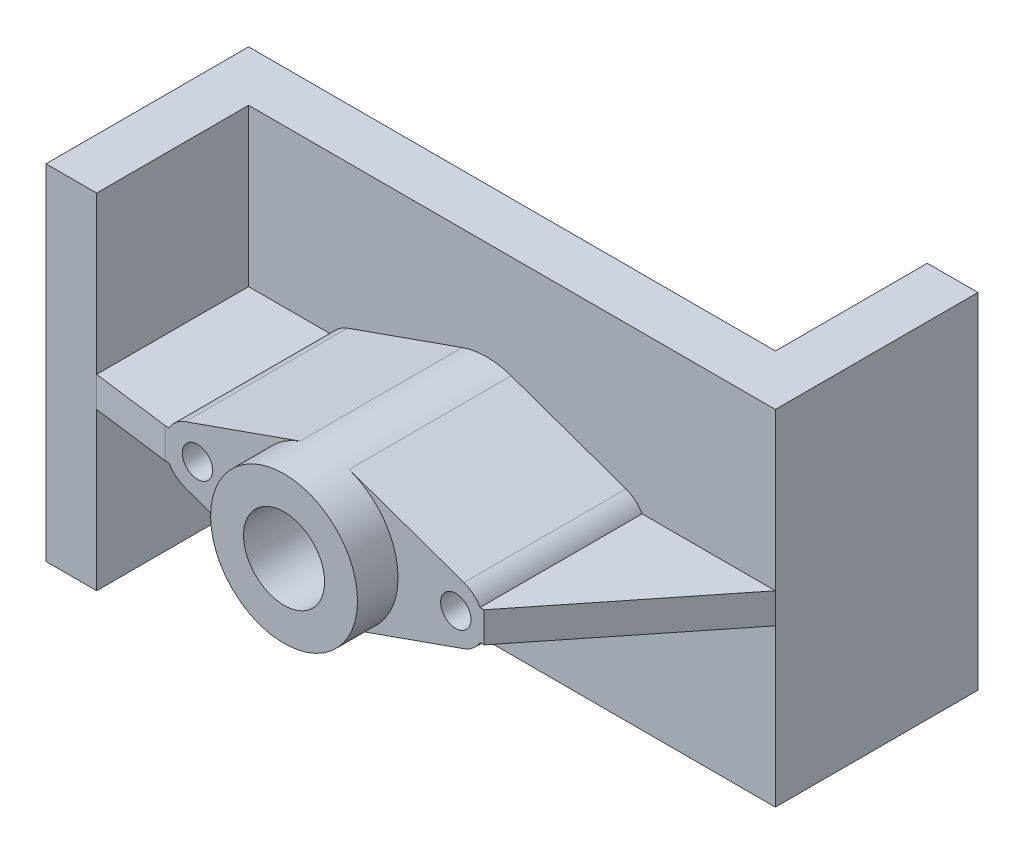
from build123d import *

# Parameters (mm, degrees)
ESTRUSIONE_ESTRUSIONE5_DEPTH = 34
ESTRUSIONE_ESTRUSIONE6_DEPTH = 32
SCHIZZO9_R                   = 14.5
ESTRUSIONE_ESTRUSIONE7_DEPTH = 8
SCHIZZO10_R                  = 8
TAGLIO_ESTRUSIONE1_DEPTH     = 104.947101932
SCHIZZO11_R                  = 3
TAGLIO_ESTRUSIONE2_DEPTH     = 98.923439482
NERVATURA1_START             = -3
NERVATURA1_DEPTH             = 6
NERVATURA11_START            = -3
NERVATURA11_DEPTH            = 6


with BuildPart() as part:
    # Schizzo7 → Estrusione-Estrusione5 (new, symmetric)
    with BuildSketch(Plane(origin=(0, 0, 0), x_dir=(1, 0, 0), z_dir=(0, 1, 0))):
        Polygon((-57, 20), (-57, -20), (-47, -20), (-47, 10), (57, 10), (57, 50), (47, 50), (47, 20), align=None)
    extrude(amount=ESTRUSIONE_ESTRUSIONE5_DEPTH, both=True)

    # Schizzo8 → Estrusione-Estrusione6 (add)
    with BuildSketch(Plane.XY.offset(-10)):
        with BuildLine():
            Line((-27.5, 5.656854249), (-4.833333333, 13.670731103))
            ThreePointArc((-4.833333333, 13.670731103), (0, 14.5), (4.833333333, 13.670731103))
            Line((4.833333333, 13.670731103), (27.5, 5.656854249))
            ThreePointArc((27.5, 5.656854249), (31.5, 0), (27.5, -5.656854249))
            Line((27.5, -5.656854249), (4.833333333, -13.670731103))
            ThreePointArc((4.833333333, -13.670731103), (0, -14.5), (-4.833333333, -13.670731103))
            Line((-4.833333333, -13.670731103), (-27.5, -5.656854249))
            ThreePointArc((-27.5, -5.656854249), (-31.5, 0), (-27.5, 5.656854249))
        make_face()
    extrude(amount=ESTRUSIONE_ESTRUSIONE6_DEPTH)

    # Schizzo9 → Estrusione-Estrusione7 (add)
    with BuildSketch(Plane.XY.offset(22)):
        with Locations(Location((0, 0, 0), (0, 0, 109.471220634))):
            Circle(SCHIZZO9_R)
    extrude(amount=ESTRUSIONE_ESTRUSIONE7_DEPTH)

    # Schizzo10 → Taglio-Estrusione1 (cut, through all)
    with BuildSketch(Plane.XY.offset(30)):
        Circle(SCHIZZO10_R)
    extrude(amount=-TAGLIO_ESTRUSIONE1_DEPTH, mode=Mode.SUBTRACT)

    # Schizzo11 → Taglio-Estrusione2 (cut, through all)
    with BuildSketch(Plane.XY.offset(22)):
        with Locations((-25.1, 0)):
            Circle(SCHIZZO11_R)
        with Locations((25.9, 0)):
            Circle(SCHIZZO11_R)
    extrude(amount=-TAGLIO_ESTRUSIONE2_DEPTH, mode=Mode.SUBTRACT)

    # Nervatura1: read off the stored shape, not the designer's step
    # Nervatura1 outline → Nervatura1 (add)
    with BuildSketch(Plane(origin=(0, 0, 0), x_dir=(1, 0, 0), z_dir=(0, 1, 0)).offset(NERVATURA1_START)):
        Polygon((31.5, -22), (57, 10), (30.696152423, 10), (30.696152423, -22), align=None)
    extrude(amount=NERVATURA1_DEPTH)

    # Nervatura11: read off the stored shape, not the designer's step
    # Nervatura11 outline → Nervatura11 (add)
    with BuildSketch(Plane(origin=(0, 0, 0), x_dir=(1, 0, 0), z_dir=(0, 1, 0)).offset(NERVATURA11_START)):
        Polygon((-30.696152423, 10), (-47, 10), (-47, -20), (-31.5, -22), (-30.696152423, -22), align=None)
    extrude(amount=NERVATURA11_DEPTH)


solid = part.part
